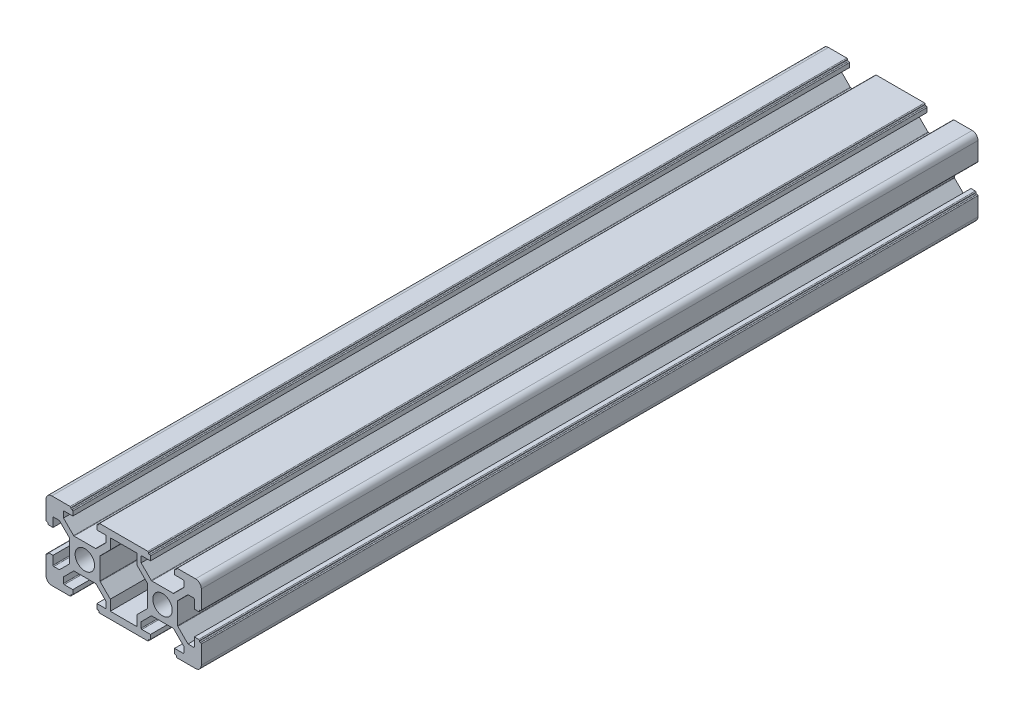
from build123d import *

# Parameters (mm, degrees)
BOSS_EXTRUDE1_DEPTH = 200
SKETCH2_R           = 2.5
CUT_EXTRUDE1_DEPTH  = 203.484567313


with BuildPart() as part:
    # Sketch1 → Boss-Extrude1 (new body)
    with BuildSketch(Plane.XY):
        with BuildLine():
            Line((-8.5, 10), (-3.8, 10))
            ThreePointArc((-3.8, 10), (-3.658578644, 9.941421356), (-3.6, 9.8))
            Line((-3.6, 9.8), (-3.6, 9.7))
            ThreePointArc((-3.6, 9.7), (-3.541421356, 9.558578644), (-3.4, 9.5))
            Line((-3.4, 9.5), (-3.3, 9.5))
            ThreePointArc((-3.3, 9.5), (-3.158578644, 9.441421356), (-3.1, 9.3))
            Line((-3.1, 9.3), (-3.1, 8.2))
            Line((-3.1, 8.2), (-5.3, 8.2))
            ThreePointArc((-5.3, 8.2), (-5.441421356, 8.141421356), (-5.5, 8))
            Line((-5.5, 8), (-5.5, 6.560660172))
            Line((-5.5, 6.560660172), (-2.897918472, 3.958578644))
            ThreePointArc((-2.897918472, 3.958578644), (-2.833033802, 3.915224093), (-2.756497116, 3.9))
            Line((-2.756497116, 3.9), (2.756497116, 3.9))
            ThreePointArc((2.756497116, 3.9), (2.833033802, 3.915224093), (2.897918472, 3.958578644))
            Line((2.897918472, 3.958578644), (5.5, 6.560660172))
            Line((5.5, 6.560660172), (5.5, 8))
            ThreePointArc((5.5, 8), (5.441421356, 8.141421356), (5.3, 8.2))
            Line((5.3, 8.2), (3.1, 8.2))
            Line((3.1, 8.2), (3.1, 9.3))
            ThreePointArc((3.1, 9.3), (3.158578644, 9.441421356), (3.3, 9.5))
            Line((3.3, 9.5), (3.4, 9.5))
            ThreePointArc((3.4, 9.5), (3.541421356, 9.558578644), (3.6, 9.7))
            Line((3.6, 9.7), (3.6, 9.8))
            ThreePointArc((3.6, 9.8), (3.658578644, 9.941421356), (3.8, 10))
            Line((3.8, 10), (8.5, 10))
            Line((8.5, 10), (11.5, 10))
            Line((11.5, 10), (16.2, 10))
            ThreePointArc((16.2, 10), (16.341421356, 9.941421356), (16.4, 9.8))
            Line((16.4, 9.8), (16.4, 9.7))
            ThreePointArc((16.4, 9.7), (16.458578644, 9.558578644), (16.6, 9.5))
            Line((16.6, 9.5), (16.7, 9.5))
            ThreePointArc((16.7, 9.5), (16.841421356, 9.441421356), (16.9, 9.3))
            Line((16.9, 9.3), (16.9, 8.2))
            Line((16.9, 8.2), (14.7, 8.2))
            ThreePointArc((14.7, 8.2), (14.558578644, 8.141421356), (14.5, 8))
            Line((14.5, 8), (14.5, 6.560660172))
            Line((14.5, 6.560660172), (17.102081528, 3.958578644))
            ThreePointArc((17.102081528, 3.958578644), (17.166966198, 3.915224093), (17.243502884, 3.9))
            Line((17.243502884, 3.9), (22.756497116, 3.9))
            ThreePointArc((22.756497116, 3.9), (22.833033802, 3.915224093), (22.897918472, 3.958578644))
            Line((22.897918472, 3.958578644), (25.5, 6.560660172))
            Line((25.5, 6.560660172), (25.5, 8))
            ThreePointArc((25.5, 8), (25.441421356, 8.141421356), (25.3, 8.2))
            Line((25.3, 8.2), (23.1, 8.2))
            Line((23.1, 8.2), (23.1, 9.3))
            ThreePointArc((23.1, 9.3), (23.158578644, 9.441421356), (23.3, 9.5))
            Line((23.3, 9.5), (23.4, 9.5))
            ThreePointArc((23.4, 9.5), (23.541421356, 9.558578644), (23.6, 9.7))
            Line((23.6, 9.7), (23.6, 9.8))
            ThreePointArc((23.6, 9.8), (23.658578644, 9.941421356), (23.8, 10))
            Line((23.8, 10), (28.5, 10))
            ThreePointArc((28.5, 10), (29.560660172, 9.560660172), (30, 8.5))
            Line((30, 8.5), (30, 3.8))
            ThreePointArc((30, 3.8), (29.941421356, 3.658578644), (29.8, 3.6))
            Line((29.8, 3.6), (29.7, 3.6))
            ThreePointArc((29.7, 3.6), (29.558578644, 3.541421356), (29.5, 3.4))
            Line((29.5, 3.4), (29.5, 3.3))
            ThreePointArc((29.5, 3.3), (29.441421356, 3.158578644), (29.3, 3.1))
            Line((29.3, 3.1), (28.2, 3.1))
            Line((28.2, 3.1), (28.2, 5.3))
            ThreePointArc((28.2, 5.3), (28.141421356, 5.441421356), (28, 5.5))
            Line((28, 5.5), (26.560660172, 5.5))
            Line((26.560660172, 5.5), (23.958578644, 2.897918472))
            ThreePointArc((23.958578644, 2.897918472), (23.915224093, 2.833033802), (23.9, 2.756497116))
            Line((23.9, 2.756497116), (23.9, -2.756497116))
            ThreePointArc((23.9, -2.756497116), (23.915224093, -2.833033802), (23.958578644, -2.897918472))
            Line((23.958578644, -2.897918472), (26.560660172, -5.5))
            Line((26.560660172, -5.5), (28, -5.5))
            ThreePointArc((28, -5.5), (28.141421356, -5.441421356), (28.2, -5.3))
            Line((28.2, -5.3), (28.2, -3.1))
            Line((28.2, -3.1), (29.3, -3.1))
            ThreePointArc((29.3, -3.1), (29.441421356, -3.158578644), (29.5, -3.3))
            Line((29.5, -3.3), (29.5, -3.4))
            ThreePointArc((29.5, -3.4), (29.558578644, -3.541421356), (29.7, -3.6))
            Line((29.7, -3.6), (29.8, -3.6))
            ThreePointArc((29.8, -3.6), (29.941421356, -3.658578644), (30, -3.8))
            Line((30, -3.8), (30, -8.5))
            ThreePointArc((30, -8.5), (29.560660172, -9.560660172), (28.5, -10))
            Line((28.5, -10), (23.8, -10))
            ThreePointArc((23.8, -10), (23.658578644, -9.941421356), (23.6, -9.8))
            Line((23.6, -9.8), (23.6, -9.7))
            ThreePointArc((23.6, -9.7), (23.541421356, -9.558578644), (23.4, -9.5))
            Line((23.4, -9.5), (23.3, -9.5))
            ThreePointArc((23.3, -9.5), (23.158578644, -9.441421356), (23.1, -9.3))
            Line((23.1, -9.3), (23.1, -8.2))
            Line((23.1, -8.2), (25.3, -8.2))
            ThreePointArc((25.3, -8.2), (25.441421356, -8.141421356), (25.5, -8))
            Line((25.5, -8), (25.5, -6.560660172))
            Line((25.5, -6.560660172), (22.897918472, -3.958578644))
            ThreePointArc((22.897918472, -3.958578644), (22.833033802, -3.915224093), (22.756497116, -3.9))
            Line((22.756497116, -3.9), (17.243502884, -3.9))
            ThreePointArc((17.243502884, -3.9), (17.166966198, -3.915224093), (17.102081528, -3.958578644))
            Line((17.102081528, -3.958578644), (14.5, -6.560660172))
            Line((14.5, -6.560660172), (14.5, -8))
            ThreePointArc((14.5, -8), (14.558578644, -8.141421356), (14.7, -8.2))
            Line((14.7, -8.2), (16.9, -8.2))
            Line((16.9, -8.2), (16.9, -9.3))
            ThreePointArc((16.9, -9.3), (16.841421356, -9.441421356), (16.7, -9.5))
            Line((16.7, -9.5), (16.6, -9.5))
            ThreePointArc((16.6, -9.5), (16.458578644, -9.558578644), (16.4, -9.7))
            Line((16.4, -9.7), (16.4, -9.8))
            ThreePointArc((16.4, -9.8), (16.341421356, -9.941421356), (16.2, -10))
            Line((16.2, -10), (11.5, -10))
            Line((11.5, -10), (8.5, -10))
            Line((8.5, -10), (3.8, -10))
            ThreePointArc((3.8, -10), (3.658578644, -9.941421356), (3.6, -9.8))
            Line((3.6, -9.8), (3.6, -9.7))
            ThreePointArc((3.6, -9.7), (3.541421356, -9.558578644), (3.4, -9.5))
            Line((3.4, -9.5), (3.3, -9.5))
            ThreePointArc((3.3, -9.5), (3.158578644, -9.441421356), (3.1, -9.3))
            Line((3.1, -9.3), (3.1, -8.2))
            Line((3.1, -8.2), (5.3, -8.2))
            ThreePointArc((5.3, -8.2), (5.441421356, -8.141421356), (5.5, -8))
            Line((5.5, -8), (5.5, -6.560660172))
            Line((5.5, -6.560660172), (2.897918472, -3.958578644))
            ThreePointArc((2.897918472, -3.958578644), (2.833033802, -3.915224093), (2.756497116, -3.9))
            Line((2.756497116, -3.9), (-2.756497116, -3.9))
            ThreePointArc((-2.756497116, -3.9), (-2.833033802, -3.915224093), (-2.897918472, -3.958578644))
            Line((-2.897918472, -3.958578644), (-5.5, -6.560660172))
            Line((-5.5, -6.560660172), (-5.5, -8))
            ThreePointArc((-5.5, -8), (-5.441421356, -8.141421356), (-5.3, -8.2))
            Line((-5.3, -8.2), (-3.1, -8.2))
            Line((-3.1, -8.2), (-3.1, -9.3))
            ThreePointArc((-3.1, -9.3), (-3.158578644, -9.441421356), (-3.3, -9.5))
            Line((-3.3, -9.5), (-3.4, -9.5))
            ThreePointArc((-3.4, -9.5), (-3.541421356, -9.558578644), (-3.6, -9.7))
            Line((-3.6, -9.7), (-3.6, -9.8))
            ThreePointArc((-3.6, -9.8), (-3.658578644, -9.941421356), (-3.8, -10))
            Line((-3.8, -10), (-8.5, -10))
            ThreePointArc((-8.5, -10), (-9.560660172, -9.560660172), (-10, -8.5))
            Line((-10, -8.5), (-10, -3.8))
            ThreePointArc((-10, -3.8), (-9.941421356, -3.658578644), (-9.8, -3.6))
            Line((-9.8, -3.6), (-9.7, -3.6))
            ThreePointArc((-9.7, -3.6), (-9.558578644, -3.541421356), (-9.5, -3.4))
            Line((-9.5, -3.4), (-9.5, -3.3))
            ThreePointArc((-9.5, -3.3), (-9.441421356, -3.158578644), (-9.3, -3.1))
            Line((-9.3, -3.1), (-8.2, -3.1))
            Line((-8.2, -3.1), (-8.2, -5.3))
            ThreePointArc((-8.2, -5.3), (-8.141421356, -5.441421356), (-8, -5.5))
            Line((-8, -5.5), (-6.560660172, -5.5))
            Line((-6.560660172, -5.5), (-3.958578644, -2.897918472))
            ThreePointArc((-3.958578644, -2.897918472), (-3.915224093, -2.833033802), (-3.9, -2.756497116))
            Line((-3.9, -2.756497116), (-3.9, 2.756497116))
            ThreePointArc((-3.9, 2.756497116), (-3.915224093, 2.833033802), (-3.958578644, 2.897918472))
            Line((-3.958578644, 2.897918472), (-6.560660172, 5.5))
            Line((-6.560660172, 5.5), (-8, 5.5))
            ThreePointArc((-8, 5.5), (-8.141421356, 5.441421356), (-8.2, 5.3))
            Line((-8.2, 5.3), (-8.2, 3.1))
            Line((-8.2, 3.1), (-9.3, 3.1))
            ThreePointArc((-9.3, 3.1), (-9.441421356, 3.158578644), (-9.5, 3.3))
            Line((-9.5, 3.3), (-9.5, 3.4))
            ThreePointArc((-9.5, 3.4), (-9.558578644, 3.541421356), (-9.7, 3.6))
            Line((-9.7, 3.6), (-9.8, 3.6))
            ThreePointArc((-9.8, 3.6), (-9.941421356, 3.658578644), (-10, 3.8))
            Line((-10, 3.8), (-10, 8.5))
            ThreePointArc((-10, 8.5), (-9.560660172, 9.560660172), (-8.5, 10))
        make_face()
        with BuildLine():
            Line((3.9, 2.756497116), (3.9, -2.756497116))
            ThreePointArc((3.9, -2.756497116), (3.915224093, -2.833033802), (3.958578644, -2.897918472))
            Line((3.958578644, -2.897918472), (6.560660172, -5.5))
            Line((6.560660172, -5.5), (6.560660172, -8.2))
            Line((6.560660172, -8.2), (13.439339828, -8.2))
            Line((13.439339828, -8.2), (13.439339828, -5.5))
            Line((13.439339828, -5.5), (16.041421356, -2.897918472))
            ThreePointArc((16.041421356, -2.897918472), (16.084775907, -2.833033802), (16.1, -2.756497116))
            Line((16.1, -2.756497116), (16.1, 2.756497116))
            ThreePointArc((16.1, 2.756497116), (16.084775907, 2.833033802), (16.041421356, 2.897918472))
            Line((16.041421356, 2.897918472), (13.439339828, 5.5))
            Line((13.439339828, 5.5), (13.439339828, 8.2))
            Line((13.439339828, 8.2), (6.560660172, 8.2))
            Line((6.560660172, 8.2), (6.560660172, 5.5))
            Line((6.560660172, 5.5), (3.958578644, 2.897918472))
            ThreePointArc((3.958578644, 2.897918472), (3.915224093, 2.833033802), (3.9, 2.756497116))
        make_face(mode=Mode.SUBTRACT)
    extrude(amount=BOSS_EXTRUDE1_DEPTH)

    # Sketch2 → Cut-Extrude1 (cut, through all)
    with BuildSketch(Plane.XY.offset(200)):
        Circle(SKETCH2_R)
        with Locations((20, 0)):
            Circle(SKETCH2_R)
    extrude(amount=-CUT_EXTRUDE1_DEPTH, mode=Mode.SUBTRACT)


solid = part.part
